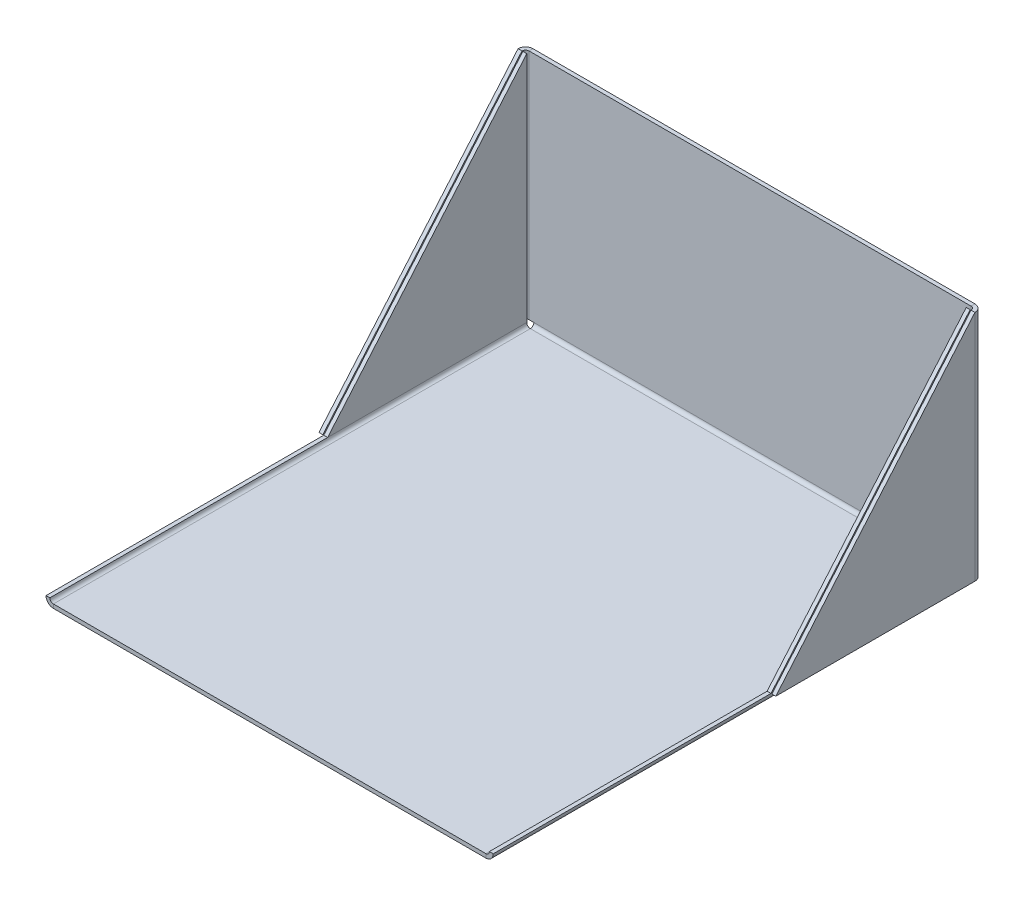
from build123d import *

# Parameters (mm, degrees)
SKETCH1_W                    = 90
SKETCH1_H                    = 100
BASE_FLANGE1_DEPTH           = 0.81
EDGE_FLANGE1_STRIP_W         = 4.7132
EDGE_FLANGE1_STRIP_H         = 0.81
EDGE_FLANGE1_STRIP_CUT_DEPTH = 90
EDGE_FLANGE1_DEPTH           = 90
EDGE_FLANGE2_DEPTH           = 48.4534
EDGE_FLANGE2_BEND_DEPTH      = 48.4534
EDGE_FLANGE3_DEPTH           = 99.2634
EDGE_FLANGE3_BEND_DEPTH      = 99.2634
CUT_EXTRUDE1_REACH           = 149.055


# Sheet-metal steps are written as plain solids
with BuildPart() as part:
    # Sketch1 → Base-Flange1 (new body)
    with BuildSketch(Plane(origin=(0, 0, 0), x_dir=(1, 0, 0), z_dir=(0, 1, 0))):
        with Locations((45, 50)):
            Rectangle(SKETCH1_W, SKETCH1_H)
    extrude(amount=-BASE_FLANGE1_DEPTH)

    # Edge-Flange1 strip (across the edge) → Edge-Flange1 strip cut (cut)
    with BuildSketch(Plane(origin=(90, 0, -100), x_dir=(0, 0, 1), z_dir=(-1, 0, 0))):
        with Locations((-1.62, -0.405)):
            Rectangle(EDGE_FLANGE1_STRIP_W, EDGE_FLANGE1_STRIP_H)
    extrude(amount=EDGE_FLANGE1_STRIP_CUT_DEPTH, mode=Mode.SUBTRACT)

    # Edge-Flange1 section (across the edge) → Edge-Flange1 (add)
    with BuildSketch(Plane(origin=(90, 0, -100), x_dir=(0, 0, 1), z_dir=(-1, 0, 0))):
        with BuildLine():
            Line((-0.81, 0.7366), (-0.81, 49.19))
            Line((-0.81, 49.19), (0, 49.19))
            Line((0, 49.19), (0, 0.7366))
            ThreePointArc((0, 0.7366), (0.215745145, 0.215745145), (0.7366, 0))
            Line((0.7366, 0), (0.7366, -0.81))
            ThreePointArc((0.7366, -0.81), (-0.357011348, -0.357011348), (-0.81, 0.7366))
        make_face()
    extrude(amount=EDGE_FLANGE1_DEPTH)

    # Edge-Flange2 section (across the edge) → Edge-Flange2 (add)
    with BuildSketch(Plane(origin=(-1.7366, 49.19, -100), x_dir=(1, 0, 0), z_dir=(0, -1, 0))):
        with BuildLine():
            Line((-0.81, 0.7366), (-0.81, 42.19))
            Line((-0.81, 42.19), (0, 42.19))
            Line((0, 42.19), (0, 0.7366))
            ThreePointArc((0, 0.7366), (0.215745145, 0.215745145), (0.7366, 0))
            Line((0.7366, 0), (1.7366, 0))
            Line((1.7366, 0), (1.7366, -0.81))
            Line((1.7366, -0.81), (0.7366, -0.81))
            ThreePointArc((0.7366, -0.81), (-0.357011348, -0.357011348), (-0.81, 0.7366))
        make_face()
    extrude(amount=EDGE_FLANGE2_DEPTH)

    # Edge-Flange2 section 2 (across the edge) → Edge-Flange2 bend (add)
    with BuildSketch(Plane(origin=(91.7366, 0.7366, -100), x_dir=(-1, 0, 0), z_dir=(0, 1, 0))):
        with BuildLine():
            Line((-0.81, 0.7366), (-0.81, 42.19))
            Line((-0.81, 42.19), (0, 42.19))
            Line((0, 42.19), (0, 0.7366))
            ThreePointArc((0, 0.7366), (0.215745145, 0.215745145), (0.7366, 0))
            Line((0.7366, 0), (1.7366, 0))
            Line((1.7366, 0), (1.7366, -0.81))
            Line((1.7366, -0.81), (0.7366, -0.81))
            ThreePointArc((0.7366, -0.81), (-0.357011348, -0.357011348), (-0.81, 0.7366))
        make_face()
    extrude(amount=EDGE_FLANGE2_BEND_DEPTH)

    # Edge-Flange3 section (across the edge) → Edge-Flange3 (add)
    with BuildSketch(Plane(origin=(-0.7366, 0, -99.2634), x_dir=(1, 0, 0), z_dir=(0, 0, 1))):
        with BuildLine():
            Line((-0.81, 0.7366), (-0.81, 49.19))
            Line((-0.81, 49.19), (0, 49.19))
            Line((0, 49.19), (0, 0.7366))
            ThreePointArc((0, 0.7366), (0.215745145, 0.215745145), (0.7366, 0))
            Line((0.7366, 0), (0.7366, -0.81))
            ThreePointArc((0.7366, -0.81), (-0.357011348, -0.357011348), (-0.81, 0.7366))
        make_face()
    extrude(amount=EDGE_FLANGE3_DEPTH)

    # Edge-Flange3 section 2 (across the edge) → Edge-Flange3 bend (add)
    with BuildSketch(Plane(origin=(90.7366, 0, 0), x_dir=(-1, 0, 0), z_dir=(0, 0, -1))):
        with BuildLine():
            Line((-0.81, 0.7366), (-0.81, 49.19))
            Line((-0.81, 49.19), (0, 49.19))
            Line((0, 49.19), (0, 0.7366))
            ThreePointArc((0, 0.7366), (0.215745145, 0.215745145), (0.7366, 0))
            Line((0.7366, 0), (0.7366, -0.81))
            ThreePointArc((0.7366, -0.81), (-0.357011348, -0.357011348), (-0.81, 0.7366))
        make_face()
    extrude(amount=EDGE_FLANGE3_BEND_DEPTH)

    # Cut-Extrude1: up to this face of the body (flat: up to its plane)
    cut_extrude1_end = Plane(part.part.faces().sort_by_distance((92.5466, 24.9633, -78.5367))[0])
    # Sketch23 → Cut-Extrude1 (cut, up to the picked face)
    with BuildSketch(Plane.ZY.offset(2.5466), mode=Mode.PRIVATE) as cut_extrude1_sk1:
        Polygon((-99.2634, 49.19), (-57.81, 0.7366), (0, 0.7366), (0, 49.19), align=None)
    cut_extrude1_tool1 = split(extrude(cut_extrude1_sk1.sketch, amount=-CUT_EXTRUDE1_REACH, mode=Mode.PRIVATE), bisect_by=cut_extrude1_end, keep=Keep.BOTH, mode=Mode.PRIVATE)
    add(cut_extrude1_tool1.solids().sort_by(Axis((-2.5466, 27.094531, -40.180017), (1, 0, 0)))[0], mode=Mode.SUBTRACT)


solid = part.part
